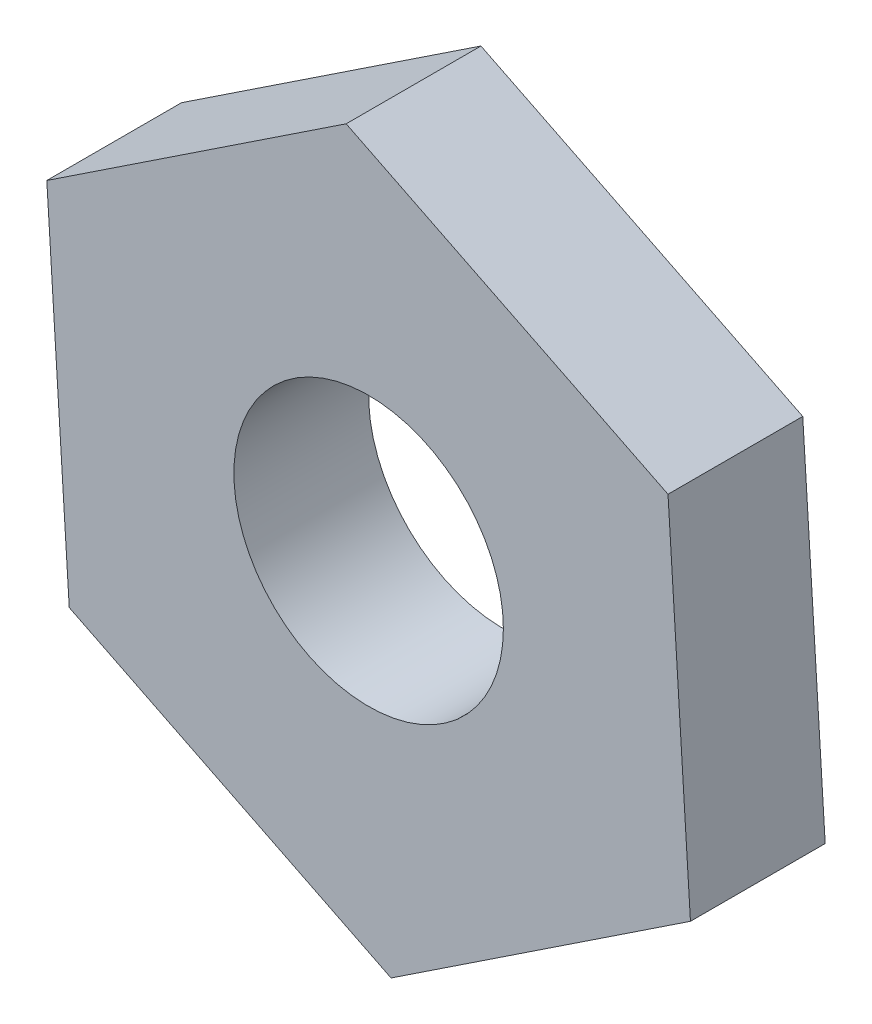
from build123d import *

# Parameters (mm, degrees)
BOSS_EXTRUDE1_DEPTH = 1.5
SKETCH2_R           = 1.5
CUT_EXTRUDE1_DEPTH  = 6.569582595


with BuildPart() as part:
    # Sketch1 → Boss-Extrude1 (new body)
    with BuildSketch(Plane.XY):
        Polygon((-3.332397475, -2.212493405), (0.249876757, -3.992187572), (3.582274232, -1.779694166), (3.332397475, 2.212493405), (-0.249876757, 3.992187572), (-3.582274232, 1.779694166), align=None)
    extrude(amount=BOSS_EXTRUDE1_DEPTH)

    # Sketch2 → Cut-Extrude1 (cut, through all)
    with BuildSketch(Plane.XY.offset(1.5)):
        Circle(SKETCH2_R)
    extrude(amount=-CUT_EXTRUDE1_DEPTH, mode=Mode.SUBTRACT)


solid = part.part
